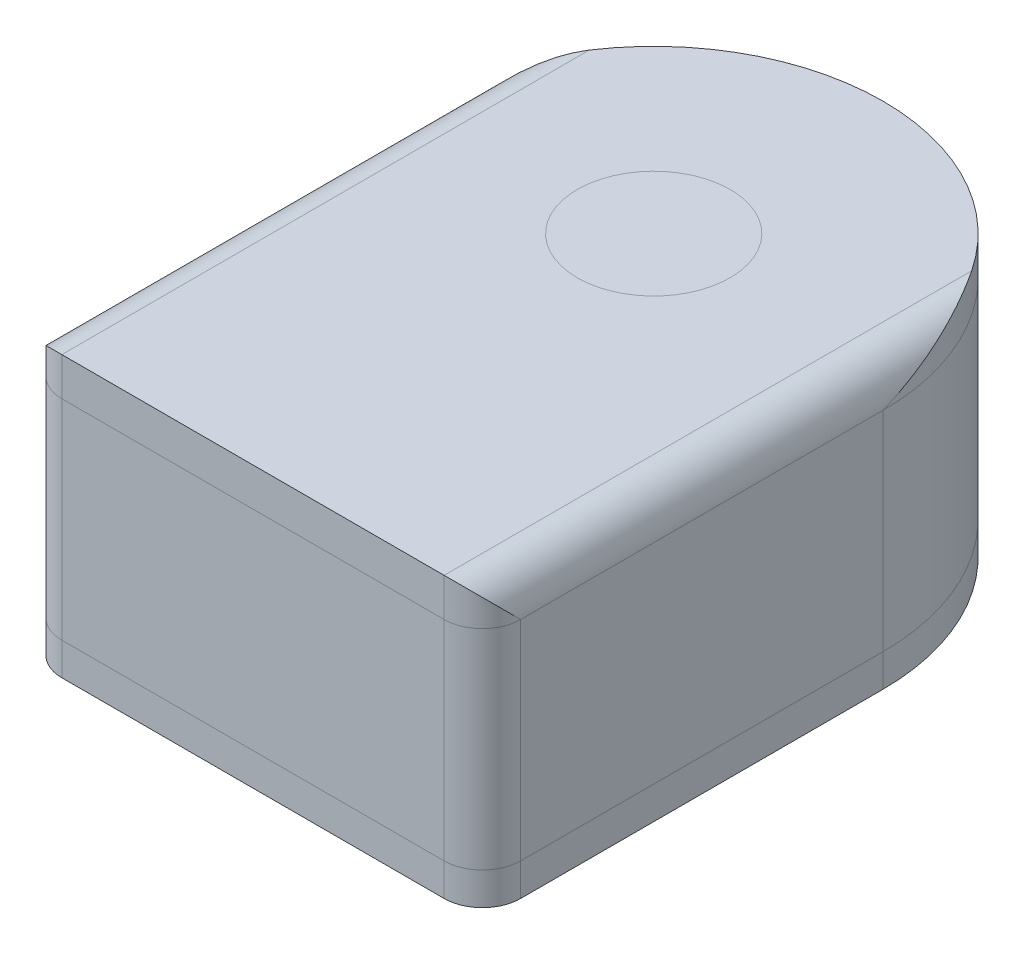
from build123d import *

# Parameters (mm, degrees)
BOSS_EXTRUDE1_DEPTH = 9.15
FILLET1_R           = 2.5
SKETCH5_R           = 0.8
CUT_EXTRUDE1_DEPTH  = 15
SKETCH8_R           = 1.25
CUT_EXTRUDE2_DEPTH  = 15
SKETCH9_R           = 5
CUT_EXTRUDE3_DEPTH  = 15
BOSS_EXTRUDE2_START = 10
SKETCH10_R          = 5
SKETCH10_R_2        = 4
BOSS_EXTRUDE2_DEPTH = 10


with BuildPart() as part:
    # Sketch1 → Boss-Extrude1 (new, symmetric)
    with BuildSketch(Plane(origin=(0, 0, 0), x_dir=(1, 0, 0), z_dir=(0, 1, 0))):
        with BuildLine():
            Line((-15, 13.1), (-15, -10.6))
            ThreePointArc((-15, -10.6), (-14.267766953, -12.367766953), (-12.5, -13.1))
            Line((-12.5, -13.1), (12.5, -13.1))
            ThreePointArc((12.5, -13.1), (14.267766953, -12.367766953), (15, -10.6))
            Line((15, -10.6), (15, 13.1))
            ThreePointArc((15, 13.1), (0, 28.1), (-15, 13.1))
        make_face()
    extrude(amount=BOSS_EXTRUDE1_DEPTH, both=True)

    # Fillet1
    # the kernel refuses this fillet: 2.5 mm, written as the material it takes off along each edge
    with BuildSketch(Plane(origin=(-15, 9.15, -28.1), x_dir=(0, -1, 0), z_dir=(0, 0, 1)), Plane(origin=(15, 9.15, 25.6), x_dir=(0, -1, 0), z_dir=(0, 0, -1))) as fillet1_piece_1:
        with BuildLine():
            CenterArc((FILLET1_R, FILLET1_R), FILLET1_R, 180, 90)
            Line((0, FILLET1_R), (-FILLET1_R * 0.02, FILLET1_R))
            Line((-FILLET1_R * 0.02, FILLET1_R), (-FILLET1_R * 0.02, -FILLET1_R * 0.02))
            Line((-FILLET1_R * 0.02, -FILLET1_R * 0.02), (FILLET1_R, -FILLET1_R * 0.02))
            Line((FILLET1_R, -FILLET1_R * 0.02), (FILLET1_R, 0))
        make_face()
    extrude(amount=53.7, mode=Mode.SUBTRACT)

    # Sketch5 → Cut-Extrude1 (cut)
    with BuildSketch(Plane.XZ.offset(9.15)):
        with Locations(Location((0, -23.55, 0), (0, 0, 270))):
            Circle(SKETCH5_R)
        with Locations(Location((-9.04996547, -7.875, 0), (0, 0, 270))):
            Circle(SKETCH5_R)
        with Locations(Location((9.04996547, -7.875, 0), (0, 0, 270))):
            Circle(SKETCH5_R)
    extrude(amount=-CUT_EXTRUDE1_DEPTH, mode=Mode.SUBTRACT)

    # Sketch8 → Cut-Extrude2 (cut)
    with BuildSketch(Plane.XZ.offset(9.15)):
        with Locations(Location((-9.525, -13.1, 0), (0, 0, 270))):
            Circle(SKETCH8_R)
        with Locations(Location((9.525, -13.1, 0), (0, 0, 270))):
            Circle(SKETCH8_R)
    extrude(amount=-CUT_EXTRUDE2_DEPTH, mode=Mode.SUBTRACT)

    # Sketch9 → Cut-Extrude3 (cut)
    with BuildSketch(Plane.XZ.offset(9.15)):
        with Locations(Location((0, -13.1, 0), (0, 0, 270))):
            Circle(SKETCH9_R)
    extrude(amount=-CUT_EXTRUDE3_DEPTH, mode=Mode.SUBTRACT)

    # Sketch10 → Boss-Extrude2 (add)
    with BuildSketch(Plane.XZ.offset(-5.85).offset(BOSS_EXTRUDE2_START)):
        with Locations(Location((0, -13.1, 0), (0, 0, 270))):
            Circle(SKETCH10_R)
        with Locations(Location((0, -13.1, 0), (0, 0, 270))):
            Circle(SKETCH10_R_2, mode=Mode.SUBTRACT)
    extrude(amount=-BOSS_EXTRUDE2_DEPTH)


solid = part.part
